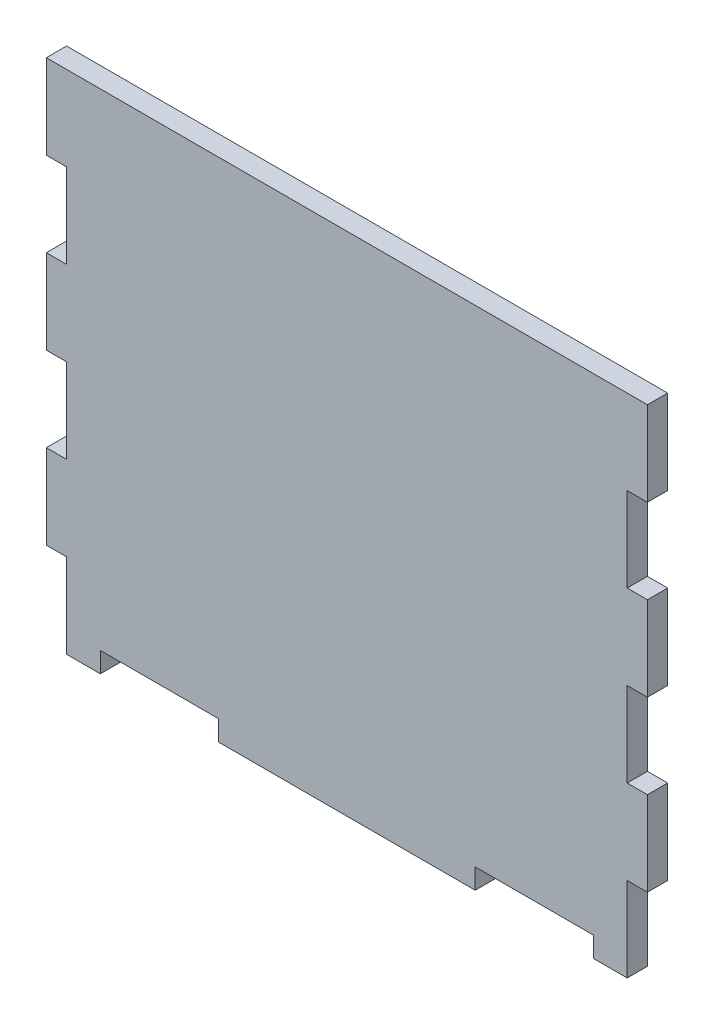
from build123d import *

# Parameters (mm, degrees)
SKETCH1_W            = 178
SKETCH1_H            = 150
BOSS_EXTRUDE1_DEPTH  = 6
SKETCH2_W            = 6
SKETCH2_H            = 25
CUT_EXTRUDE1_DEPTH   = 6
LPATTERN1_COUNT      = 3
LPATTERN1_PITCH      = 50
LPATTERN1_COUNT_DIR2 = 2
LPATTERN1_PITCH_DIR2 = 172
SKETCH3_W            = 35
SKETCH3_H            = 6
CUT_EXTRUDE2_DEPTH   = 233.851884253


with BuildPart() as part:
    # Sketch1 → Boss-Extrude1 (new body)
    with BuildSketch(Plane.XY):
        with Locations((-89, 75)):
            Rectangle(SKETCH1_W, SKETCH1_H)
    extrude(amount=BOSS_EXTRUDE1_DEPTH)

    # Sketch2 → Cut-Extrude1 (cut)
    with BuildSketch(Plane.XY.offset(6)):
        with Locations((-175, 112.5)):
            Rectangle(SKETCH2_W, SKETCH2_H)
    cut_extrude1 = extrude(amount=-CUT_EXTRUDE1_DEPTH, mode=Mode.SUBTRACT)

    # LPattern1: Cut-Extrude1 3 × 2
    with Locations(*[(j * LPATTERN1_PITCH_DIR2, -i * LPATTERN1_PITCH, 0) for i in range(LPATTERN1_COUNT) for j in range(LPATTERN1_COUNT_DIR2) if (i, j) != (0, 0)]):
        add(cut_extrude1, mode=Mode.SUBTRACT)

    # Sketch3 → Cut-Extrude2 (cut, through all)
    with BuildSketch(Plane.XY.offset(6)):
        with Locations((-33.5, 3)):
            Rectangle(SKETCH3_W, SKETCH3_H)
        with Locations((-144.5, 3)):
            Rectangle(SKETCH3_W, SKETCH3_H)
    extrude(amount=-CUT_EXTRUDE2_DEPTH, mode=Mode.SUBTRACT)


solid = part.part
